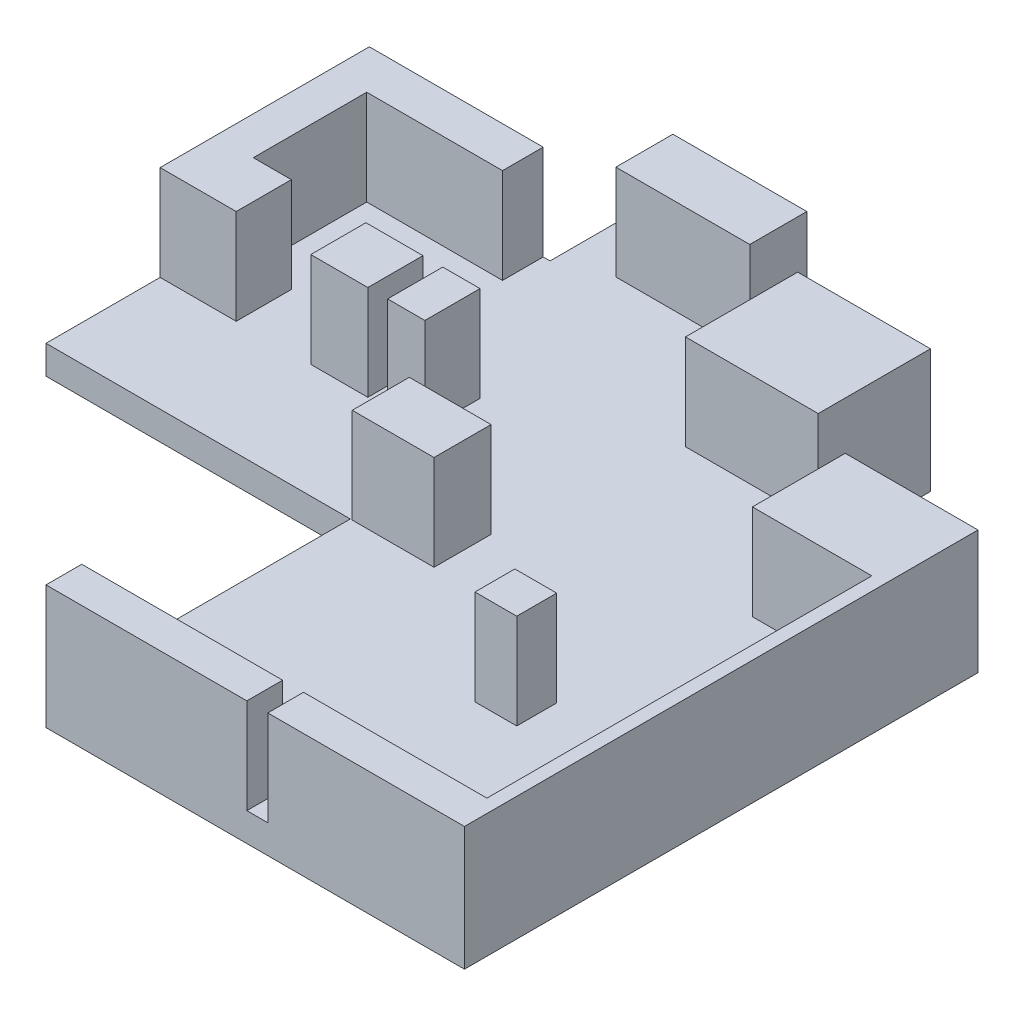
from build123d import *

# Parameters (mm, degrees)
BOSS_EXTRUDE1_DEPTH     = 3.75
SKETCH2_W               = 17.7
SKETCH2_H               = 14.8
SKETCH2_H_2             = 17.5
SKETCH2_W_2             = 7.5
SKETCH2_H_3             = 22.5
SKETCH2_H_4             = 10
SKETCH2_W_3             = 26.4
SKETCH2_H_5             = 4.8
SKETCH2_W_4             = 11
SKETCH2_H_6             = 7.5
SKETCH2_W_5             = 10
SKETCH2_W_6             = 23.1
SKETCH2_H_7             = 7.843975032
SKETCH2_W_7             = 26.1
SKETCH2_W_8             = 5
SKETCH2_W_9             = 5.5
SKETCH2_H_8             = 5.25
BOSS_EXTRUDE2_DEPTH     = 12.5
SKETCH5_W               = 23.75
SKETCH5_H               = 2.5
CUT_EXTRUDE2_DEPTH      = 136.329459099
BOSS_EXTRUDE3_DEPTH     = 15
CHAMFER1_SIZE           = 3.75
CUT_EXTRUDE3_DEPTH      = 137.811814183
CUT_EXTRUDE3_DEPTH_BACK = 12.5
SKETCH7_W               = 0.25
SKETCH7_H               = 5.343975032
SKETCH7_W_2             = 0.1
SKETCH7_H_2             = 7.5
SKETCH7_H_3             = 15
SKETCH7_H_4             = 12.3
SKETCH7_H_5             = 4.8
CUT_EXTRUDE4_DEPTH      = 137.811814183
CUT_EXTRUDE4_DEPTH_BACK = 12.5
SKETCH9_W               = 17.45
SKETCH9_H               = 0.1
SKETCH9_H_2             = 0.25
SKETCH9_W_2             = 34.8
SKETCH9_W_3             = 55
SKETCH10_W              = 1.75
SKETCH10_H              = 50.6
SKETCH10_W_2            = 5
SKETCH10_H_2            = 14.906024968
BOSS_EXTRUDE5_DEPTH     = 12.5


with BuildPart() as part:
    # Sketch1 → Boss-Extrude1 (new body)
    with BuildSketch(Plane(origin=(0, 0, 0), x_dir=(1, 0, 0), z_dir=(0, 1, 0))):
        Polygon((40, 0), (95, 0), (95, 70), (71.25, 70), (71.25, 87.5), (47.5, 87.5), (47.5, 95), (23.75, 95), (23.75, 85), (0, 85), (0, 40), (40, 40), align=None)
    extrude(amount=BOSS_EXTRUDE1_DEPTH)

    # Sketch2 → Boss-Extrude2 (add)
    with BuildSketch(Plane(origin=(0, 3.75, 0), x_dir=(1, 0, 0), z_dir=(0, 1, 0))):
        with Locations((86.15, 62.6)):
            Rectangle(SKETCH2_W, SKETCH2_H)
        with Locations((62.4, 78.75)):
            Rectangle(SKETCH2_W, SKETCH2_H_2)
        with Locations((23.55, 51.25)):
            Rectangle(SKETCH2_W_2, SKETCH2_H_3)
        with Locations((38.65, 90)):
            Rectangle(SKETCH2_W, SKETCH2_H_4)
        with Locations((53.2, 2.4)):
            Rectangle(SKETCH2_W_3, SKETCH2_H_5)
        with Locations((45.5, 43.75)):
            Rectangle(SKETCH2_W_4, SKETCH2_H_6)
        with Locations((5, 51.25)):
            Rectangle(SKETCH2_W_5, SKETCH2_H_3)
        with Locations((11.55, 81.078012484)):
            Rectangle(SKETCH2_W_6, SKETCH2_H_7)
        with Locations((81.95, 2.4)):
            Rectangle(SKETCH2_W_7, SKETCH2_H_5)
        with Locations((32.3, 51.25)):
            Rectangle(SKETCH2_W_8, SKETCH2_H_3)
        with Locations((71.75, 30)):
            Rectangle(SKETCH2_W_9, SKETCH2_H_8)
    extrude(amount=BOSS_EXTRUDE2_DEPTH)

    # Sketch5 → Cut-Extrude2 (cut, through all)
    with BuildSketch(Plane.XZ):
        with Locations((11.875, -83.75)):
            Rectangle(SKETCH5_W, SKETCH5_H)
        with Locations((59.375, -86.25)):
            Rectangle(SKETCH5_W, SKETCH5_H)
        with Locations((35.625, -93.75)):
            Rectangle(SKETCH5_W, SKETCH5_H)
        with Locations((83.125, -68.75)):
            Rectangle(SKETCH5_W, SKETCH5_H)
    extrude(amount=-CUT_EXTRUDE2_DEPTH, mode=Mode.SUBTRACT)

    # Sketch6 → Boss-Extrude3 (add)
    with BuildSketch(Plane.XZ):
        with BuildLine():
            Line((59.15, -87.9), (57.5, -87.9))
            ThreePointArc((57.5, -87.9), (56.65, -88.75), (57.5, -89.6))
            Line((57.5, -89.6), (62.5, -89.6))
            ThreePointArc((62.5, -89.6), (63.35, -88.75), (62.5, -87.9))
            Line((62.5, -87.9), (60.85, -87.9))
            Line((60.85, -87.9), (60.85, -85))
            ThreePointArc((60.85, -85), (60, -84.15), (59.15, -85))
            Line((59.15, -85), (59.15, -87.9))
        make_face()
        with BuildLine():
            Line((37.1, -95.4), (38.75, -95.4))
            ThreePointArc((38.75, -95.4), (39.6, -96.25), (38.75, -97.1))
            Line((38.75, -97.1), (33.75, -97.1))
            ThreePointArc((33.75, -97.1), (32.9, -96.25), (33.75, -95.4))
            Line((33.75, -95.4), (35.4, -95.4))
            Line((35.4, -95.4), (35.4, -92.5))
            ThreePointArc((35.4, -92.5), (36.25, -91.65), (37.1, -92.5))
            Line((37.1, -92.5), (37.1, -95.4))
        make_face()
        with BuildLine():
            Line((13.35, -85.4), (15, -85.4))
            ThreePointArc((15, -85.4), (15.85, -86.25), (15, -87.1))
            Line((15, -87.1), (10, -87.1))
            ThreePointArc((10, -87.1), (9.15, -86.25), (10, -85.4))
            Line((10, -85.4), (11.65, -85.4))
            Line((11.65, -85.4), (11.65, -82.5))
            ThreePointArc((11.65, -82.5), (12.5, -81.65), (13.35, -82.5))
            Line((13.35, -82.5), (13.35, -85.4))
        make_face()
        with BuildLine():
            Line((81.25, -70.4), (82.9, -70.4))
            Line((82.9, -70.4), (82.9, -67.5))
            ThreePointArc((82.9, -67.5), (83.75, -66.65), (84.6, -67.5))
            Line((84.6, -67.5), (84.6, -70.4))
            Line((84.6, -70.4), (86.25, -70.4))
            ThreePointArc((86.25, -70.4), (87.1, -71.25), (86.25, -72.1))
            Line((86.25, -72.1), (81.25, -72.1))
            ThreePointArc((81.25, -72.1), (80.4, -71.25), (81.25, -70.4))
        make_face()
    extrude(amount=-BOSS_EXTRUDE3_DEPTH)

    # Chamfer1
    # the kernel refuses this chamfer: 3.75 mm, written as the material it takes off along each edge
    with BuildSketch(Plane(origin=(47.856188795, 15, -89.6), x_dir=(0, 0.027495876610586334, 0.9996219169112968), z_dir=(1, 0, 0))) as chamfer1_piece_1:
        Polygon((CHAMFER1_SIZE * 0.999621916911, CHAMFER1_SIZE * 0.0274958766106), (-CHAMFER1_SIZE * 0.0274958766106, CHAMFER1_SIZE * 0.999621916911), (0, 0), align=None)
    extrude(amount=24.28762241, mode=Mode.SUBTRACT)
    with BuildSketch(Plane(origin=(48.393811205, 15, -97.1), x_dir=(0, 0.027495876610586334, 0.9996219169112968), z_dir=(-1, 0, 0)), Plane(origin=(95.893811205, 15, -72.1), x_dir=(0, 0.027495876610586334, 0.9996219169112968), z_dir=(-1, 0, 0)), Plane(origin=(24.643811205, 15, -87.1), x_dir=(0, 0.027495876610586334, 0.9996219169112968), z_dir=(-1, 0, 0))) as chamfer1_piece_2:
        Polygon((CHAMFER1_SIZE * 0.999621916911, -CHAMFER1_SIZE * 0.0274958766106), (-CHAMFER1_SIZE * 0.0274958766106, -CHAMFER1_SIZE * 0.999621916911), (0, 0), align=None)
    extrude(amount=24.28762241, mode=Mode.SUBTRACT)

    # Sketch7 → Cut-Extrude3 (cut, two sides: drawn at the far end of the back side and taken through both)
    with BuildSketch(Plane(origin=(0, 16.25, 0), x_dir=(1, 0, 0), z_dir=(0, 1, 0)).offset(-CUT_EXTRUDE3_DEPTH_BACK)):
        with Locations((22.975, 79.828012484)):
            Rectangle(SKETCH7_W, SKETCH7_H)
        with Locations((29.85, 88.75)):
            Rectangle(SKETCH7_W_2, SKETCH7_H_2)
        Polygon((29.8, 62.5), (29.9, 62.5), (29.9, 55), (34.8, 55), (34.8, 40), (0, 40), (0, 55), (29.8, 55), align=None)
        with Locations((53.675, 77.5)):
            Rectangle(SKETCH7_W, SKETCH7_H_3)
        with Locations((40.125, 43.75)):
            Rectangle(SKETCH7_W, SKETCH7_H_2)
        with Locations((77.425, 61.35)):
            Rectangle(SKETCH7_W, SKETCH7_H_4)
        with Locations((69.025, 2.4)):
            Rectangle(SKETCH7_W, SKETCH7_H_5)
    extrude(amount=CUT_EXTRUDE3_DEPTH + CUT_EXTRUDE3_DEPTH_BACK, mode=Mode.SUBTRACT)

    # Sketch9 → Cut-Extrude4 (cut, two sides: drawn at the far end of the back side and taken through both)
    with BuildSketch(Plane(origin=(0, 16.25, 0), x_dir=(1, 0, 0), z_dir=(0, 1, 0)).offset(-CUT_EXTRUDE4_DEPTH_BACK)):
        with Locations((86.275, 55.25)):
            Rectangle(SKETCH9_W, SKETCH9_H)
        with Locations((62.525, 70.125)):
            Rectangle(SKETCH9_W, SKETCH9_H_2)
        with Locations((17.4, 62.375)):
            Rectangle(SKETCH9_W_2, SKETCH9_H_2)
        with Locations((67.5, 4.75)):
            Rectangle(SKETCH9_W_3, SKETCH9_H)
    extrude(amount=CUT_EXTRUDE4_DEPTH + CUT_EXTRUDE4_DEPTH_BACK, mode=Mode.SUBTRACT)

    # Sketch10 → Boss-Extrude5 (add)
    with BuildSketch(Plane(origin=(0, 3.75, 0), x_dir=(1, 0, 0), z_dir=(0, 1, 0))):
        with Locations((94.125, 30)):
            Rectangle(SKETCH10_W, SKETCH10_H)
        with Locations((2.5, 69.703012484)):
            Rectangle(SKETCH10_W_2, SKETCH10_H_2)
    extrude(amount=BOSS_EXTRUDE5_DEPTH)


solid = part.part
